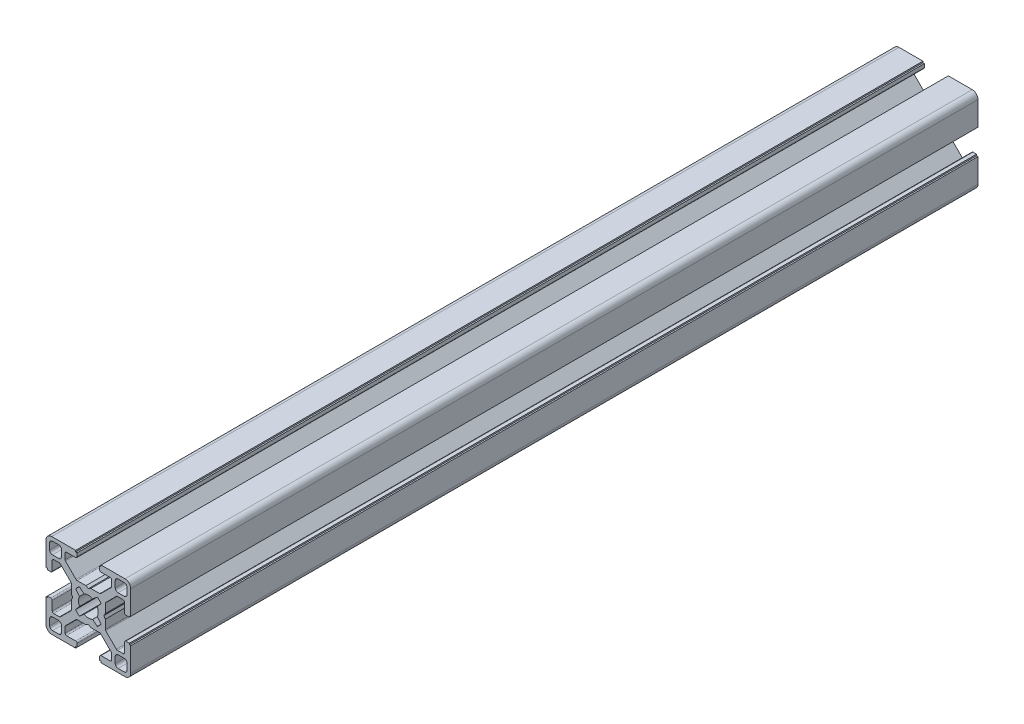
from build123d import *

# Parameters (mm, degrees)
BOSS_EXTRUDE1_DEPTH = 150
CIRPATTERN1_COUNT   = 4


with BuildPart() as part:
    # Sketch3 → Boss-Extrude1 (new, symmetric)
    with BuildSketch(Plane.XY):
        with BuildLine():
            Line((-4.503841895, 3.156803476), (-3.14772708, 1.530298739))
            ThreePointArc((-3.14772708, 1.530298739), (-3.410794979, 0.785160882), (-3.5, 0))
            Line((-3.5, 0), (-5.5, 0))
            Line((-5.5, 0), (-6, 0.866025404))
            Line((-6, 0.866025404), (-6, 3.996841995))
            ThreePointArc((-6, 3.996841995), (-6.038060234, 4.188183711), (-6.146446609, 4.350395385))
            Line((-6.146446609, 4.350395385), (-9.917104615, 8.121053391))
            ThreePointArc((-9.917104615, 8.121053391), (-10.079316289, 8.229439766), (-10.270658005, 8.2675))
            Line((-10.270658005, 8.2675), (-12.29, 8.2675))
            ThreePointArc((-12.29, 8.2675), (-12.643553391, 8.121053391), (-12.79, 7.7675))
            Line((-12.79, 7.7675), (-12.79, 4.5))
            ThreePointArc((-12.79, 4.5), (-12.936446609, 4.146446609), (-13.29, 4))
            Line((-13.29, 4), (-14.5, 4))
            Line((-14.5, 4), (-14.5, 4.5))
            Line((-14.5, 4.5), (-15, 4.5))
            Line((-15, 4.5), (-15, 12.968))
            ThreePointArc((-15, 12.968), (-14.404840979, 14.404840979), (-12.968, 15))
            Line((-12.968, 15), (-4.5, 15))
            Line((-4.5, 15), (-4.5, 14.5))
            Line((-4.5, 14.5), (-4, 14.5))
            Line((-4, 14.5), (-4, 13.29))
            ThreePointArc((-4, 13.29), (-4.146446609, 12.936446609), (-4.5, 12.79))
            Line((-4.5, 12.79), (-7.7675, 12.79))
            ThreePointArc((-7.7675, 12.79), (-8.121053391, 12.643553391), (-8.2675, 12.29))
            Line((-8.2675, 12.29), (-8.2675, 10.270658005))
            ThreePointArc((-8.2675, 10.270658005), (-8.229439766, 10.079316289), (-8.121053391, 9.917104615))
            Line((-8.121053391, 9.917104615), (-4.350395385, 6.146446609))
            ThreePointArc((-4.350395385, 6.146446609), (-4.188183711, 6.038060234), (-3.996841995, 6))
            Line((-3.996841995, 6), (-0.866025404, 6))
            Line((-0.866025404, 6), (0, 5.5))
            Line((0, 5.5), (0, 3.5))
            ThreePointArc((0, 3.5), (-0.785160882, 3.410794979), (-1.530298739, 3.14772708))
            Line((-1.530298739, 3.14772708), (-3.156803476, 4.503841895))
            ThreePointArc((-3.156803476, 4.503841895), (-3.889087297, 3.889087297), (-4.503841895, 3.156803476))
        make_face()
        with BuildLine():
            Line((-12.705, 9.5135), (-10.5135, 9.5135))
            ThreePointArc((-10.5135, 9.5135), (-9.806393219, 9.806393219), (-9.5135, 10.5135))
            Line((-9.5135, 10.5135), (-9.5135, 12.705))
            ThreePointArc((-9.5135, 12.705), (-9.806393219, 13.412106781), (-10.5135, 13.705))
            Line((-10.5135, 13.705), (-12.705, 13.705))
            ThreePointArc((-12.705, 13.705), (-13.412106781, 13.412106781), (-13.705, 12.705))
            Line((-13.705, 12.705), (-13.705, 10.5135))
            ThreePointArc((-13.705, 10.5135), (-13.412106781, 9.806393219), (-12.705, 9.5135))
        make_face(mode=Mode.SUBTRACT)
    boss_extrude1 = extrude(amount=BOSS_EXTRUDE1_DEPTH, both=True)

    # CirPattern1: Boss-Extrude1 ×4 about axis
    cirpattern1_axis = Axis((0, 0, 76.2), (0, 0, -1))
    for i in range(1, CIRPATTERN1_COUNT):
        add(boss_extrude1.rotate(cirpattern1_axis, i * 360 / CIRPATTERN1_COUNT))


solid = part.part
